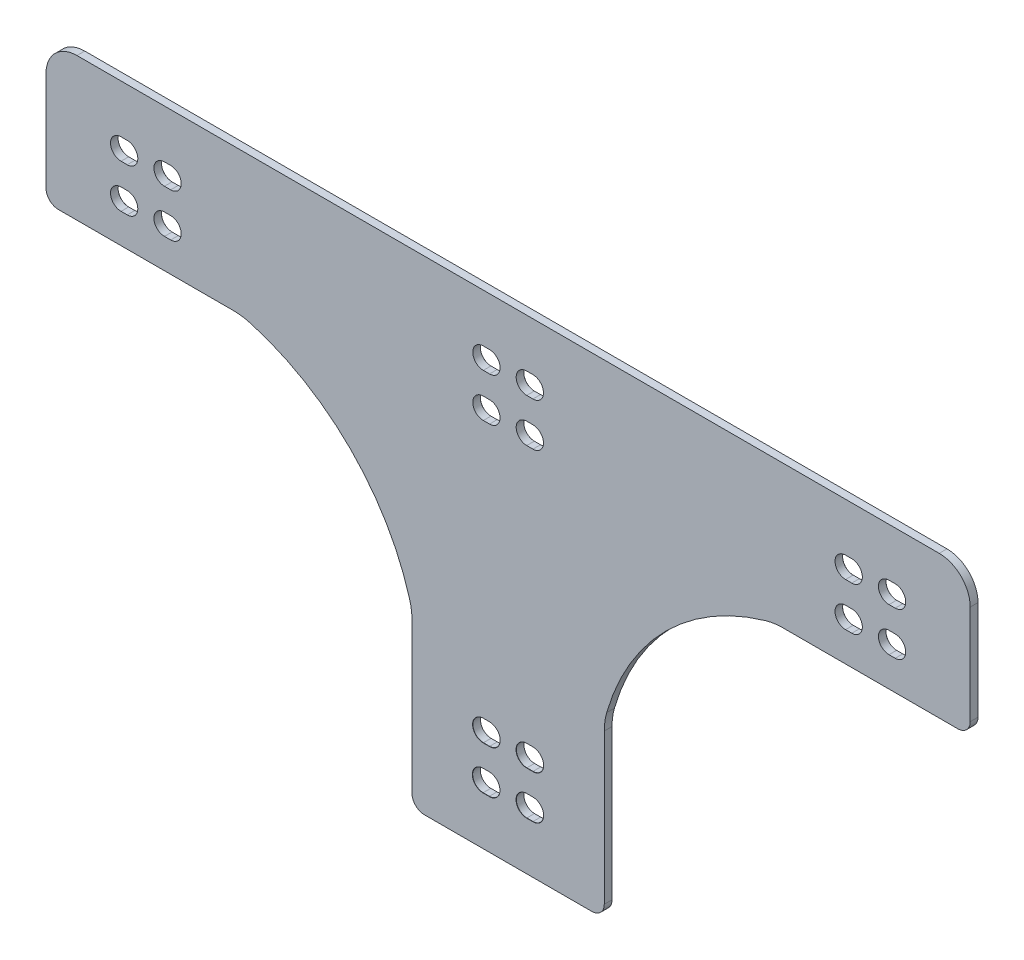
from build123d import *

# Parameters (mm, degrees)
SKETCH2_W                = 1.25
SKETCH2_H                = 78
BASE_FLANGE1_DEPTH       = 149
SKETCH8_W                = 59
SKETCH8_H                = 55
CUT_EXTRUDE1_DEPTH       = 155.024551614
FILLET2_R                = 5
TAB1_DEPTH               = 1.25
FILLET4_R                = 2
FILLET6_R                = 10
M3_START                 = -2
M3_CLEARANCE_SLOT2_DEPTH = 3
M3_START_2               = -1.25
M3_CLEARANCE_SLOT3_DEPTH = 1.25
FILLET7_R                = 2


with BuildPart() as part:
    # Base-Flange1: sheet metal written as solids
    # Sketch2 → Base-Flange1 (new body)
    with BuildSketch(Plane(origin=(0, 0, 0), x_dir=(0, 0, -1), z_dir=(1, 0, 0))):
        with Locations((0.625, 0)):
            Rectangle(SKETCH2_W, SKETCH2_H)
    extrude(amount=BASE_FLANGE1_DEPTH)

    # Sketch8 → Cut-Extrude1 (cut, through all)
    with BuildSketch(Plane.XY):
        with Locations((29.5, -11.5)):
            Rectangle(SKETCH8_W, SKETCH8_H)
        with Locations((119.5, -11.5)):
            Rectangle(SKETCH8_W, SKETCH8_H)
    extrude(amount=-CUT_EXTRUDE1_DEPTH, mode=Mode.SUBTRACT)

    # Fillet2
    fillet2_edges = [part.edges().sort_by_distance(p)[0] for p in [
        (0, 39, -0.625),
        (149, 39, -0.625),
    ]]
    fillet(fillet2_edges, radius=FILLET2_R)

    # Tab1: sheet metal written as solids
    # Sketch9 → Tab1 (add)
    with BuildSketch(Plane.XY):
        with BuildLine():
            Line((117.5, 16), (90, 16))
            Line((90, 16), (90, -11.5))
            ThreePointArc((90, -11.5), (99.90644214, 6.09355786), (117.5, 16))
        make_face()
        with BuildLine():
            Line((59, 16), (59, -11.5))
            ThreePointArc((59, -11.5), (49.09355786, 6.09355786), (31.5, 16))
            Line((31.5, 16), (59, 16))
        make_face()
    extrude(amount=-TAB1_DEPTH)

    # Fillet4
    fillet4_edges = [part.edges().sort_by_distance(p)[0] for p in [
        (0, 16, -0.625),
        (149, 16, -0.625),
    ]]
    fillet(fillet4_edges, radius=FILLET4_R)

    # Fillet6
    fillet6_edges = [part.edges().sort_by_distance(p)[0] for p in [
        (117.5, 16, -0.625),
        (90, -11.5, -0.625),
        (59, -11.5, -0.625),
        (31.5, 16, -0.625),
    ]]
    fillet(fillet6_edges, radius=FILLET6_R)

    # M3 Clearance Slot2: read off the stored shape, not the designer's step
    # M3 Clearance Slot2 outline → M3 Clearance Slot2 (cut)
    with BuildSketch(Plane.XY.offset(M3_START)):
        with BuildLine():
            Line((77.5, -31.2), (78.5, -31.2))
            ThreePointArc((78.5, -31.2), (80.2, -29.5), (78.5, -27.8))
            Line((78.5, -27.8), (77.5, -27.8))
            ThreePointArc((77.5, -27.8), (75.8, -29.5), (77.5, -31.2))
        make_face()
        with BuildLine():
            ThreePointArc((71.461664681, -31.2), (73.161664681, -29.5), (71.461664681, -27.8))
            Line((71.461664681, -27.8), (70.461664681, -27.8))
            ThreePointArc((70.461664681, -27.8), (68.761664681, -29.5), (70.461664681, -31.2))
            Line((70.461664681, -31.2), (71.461664681, -31.2))
        make_face()
        with BuildLine():
            ThreePointArc((71.5, -24.2), (73.2, -22.5), (71.5, -20.8))
            Line((71.5, -20.8), (70.5, -20.8))
            ThreePointArc((70.5, -20.8), (68.8, -22.5), (70.5, -24.2))
            Line((70.5, -24.2), (71.5, -24.2))
        make_face()
        with BuildLine():
            ThreePointArc((78.5, -24.2), (80.2, -22.5), (78.5, -20.8))
            Line((78.5, -20.8), (77.5, -20.8))
            ThreePointArc((77.5, -20.8), (75.8, -22.5), (77.5, -24.2))
            Line((77.5, -24.2), (78.5, -24.2))
        make_face()
    extrude(amount=M3_CLEARANCE_SLOT2_DEPTH, mode=Mode.SUBTRACT)

    # M3 Clearance Slot2 2: loft between two sections, ruled curve by curve
    m3_clearance_slot2_2_from = [
        Edge.make_three_point_arc((78.5, -31.2, -0.025), (79.702081528, -30.702081528, -0.025), (80.2, -29.5, -0.025)),
        Edge.make_three_point_arc((80.2, -29.5, -0.025), (79.702081528, -28.297918472, -0.025), (78.5, -27.8, -0.025)),
        Edge.make_three_point_arc((77.5, -27.8, -0.025), (76.297918472, -28.297918472, -0.025), (75.8, -29.5, -0.025)),
        Edge.make_three_point_arc((75.8, -29.5, -0.025), (76.297918472, -30.702081528, -0.025), (77.5, -31.2, -0.025)),
        Edge.make_line((78.5, -27.8, -0.025), (77.5, -27.8, -0.025)),
        Edge.make_line((78.5, -31.2, -0.025), (77.5, -31.2, -0.025)),
    ]
    m3_clearance_slot2_2_to = [
        Edge.make_three_point_arc((78.5, -31.225, 0), (79.719759198, -30.719759198, 0), (80.225, -29.5, 0)),
        Edge.make_three_point_arc((80.225, -29.5, 0), (79.719759198, -28.280240802, 0), (78.5, -27.775, 0)),
        Edge.make_three_point_arc((77.5, -27.775, 0), (76.280240802, -28.280240802, 0), (75.775, -29.5, 0)),
        Edge.make_three_point_arc((75.775, -29.5, 0), (76.280240802, -30.719759198, 0), (77.5, -31.225, 0)),
        Edge.make_line((78.5, -27.775, 0), (77.5, -27.775, 0)),
        Edge.make_line((78.5, -31.225, 0), (77.5, -31.225, 0)),
    ]
    m3_clearance_slot2_2 = Solid(Shell([*[Face.make_surface_from_curves(m3_clearance_slot2_2_from[k], m3_clearance_slot2_2_to[k]) for k in range(6)], Face(Wire(m3_clearance_slot2_2_from)), Face(Wire(m3_clearance_slot2_2_to))]))
    add(m3_clearance_slot2_2, mode=Mode.SUBTRACT)

    # M3 Clearance Slot2 3: loft between two sections, ruled curve by curve
    m3_clearance_slot2_3_from = [
        Edge.make_three_point_arc((71.461664681, -31.2, -0.025), (72.663746209, -30.702081528, -0.025), (73.161664681, -29.5, -0.025)),
        Edge.make_three_point_arc((73.161664681, -29.5, -0.025), (72.663746209, -28.297918472, -0.025), (71.461664681, -27.8, -0.025)),
        Edge.make_three_point_arc((70.461664681, -27.8, -0.025), (69.259583153, -28.297918472, -0.025), (68.761664681, -29.5, -0.025)),
        Edge.make_three_point_arc((68.761664681, -29.5, -0.025), (69.259583153, -30.702081528, -0.025), (70.461664681, -31.2, -0.025)),
        Edge.make_line((71.461664681, -27.8, -0.025), (70.461664681, -27.8, -0.025)),
        Edge.make_line((71.461664681, -31.2, -0.025), (70.461664681, -31.2, -0.025)),
    ]
    m3_clearance_slot2_3_to = [
        Edge.make_three_point_arc((71.461664681, -31.225, 0), (72.681423878, -30.719759198, 0), (73.186664681, -29.5, 0)),
        Edge.make_three_point_arc((73.186664681, -29.5, 0), (72.681423878, -28.280240802, 0), (71.461664681, -27.775, 0)),
        Edge.make_three_point_arc((70.461664681, -27.775, 0), (69.241905483, -28.280240802, 0), (68.736664681, -29.5, 0)),
        Edge.make_three_point_arc((68.736664681, -29.5, 0), (69.241905483, -30.719759198, 0), (70.461664681, -31.225, 0)),
        Edge.make_line((71.461664681, -27.775, 0), (70.461664681, -27.775, 0)),
        Edge.make_line((71.461664681, -31.225, 0), (70.461664681, -31.225, 0)),
    ]
    m3_clearance_slot2_3 = Solid(Shell([*[Face.make_surface_from_curves(m3_clearance_slot2_3_from[k], m3_clearance_slot2_3_to[k]) for k in range(6)], Face(Wire(m3_clearance_slot2_3_from)), Face(Wire(m3_clearance_slot2_3_to))]))
    add(m3_clearance_slot2_3, mode=Mode.SUBTRACT)

    # M3 Clearance Slot2 4: loft between two sections, ruled curve by curve
    m3_clearance_slot2_4_from = [
        Edge.make_three_point_arc((71.5, -24.2, -0.025), (72.702081528, -23.702081528, -0.025), (73.2, -22.5, -0.025)),
        Edge.make_three_point_arc((73.2, -22.5, -0.025), (72.702081528, -21.297918472, -0.025), (71.5, -20.8, -0.025)),
        Edge.make_three_point_arc((70.5, -20.8, -0.025), (69.297918472, -21.297918472, -0.025), (68.8, -22.5, -0.025)),
        Edge.make_three_point_arc((68.8, -22.5, -0.025), (69.297918472, -23.702081528, -0.025), (70.5, -24.2, -0.025)),
        Edge.make_line((71.5, -20.8, -0.025), (70.5, -20.8, -0.025)),
        Edge.make_line((71.5, -24.2, -0.025), (70.5, -24.2, -0.025)),
    ]
    m3_clearance_slot2_4_to = [
        Edge.make_three_point_arc((71.5, -24.225, 0), (72.719759198, -23.719759198, 0), (73.225, -22.5, 0)),
        Edge.make_three_point_arc((73.225, -22.5, 0), (72.719759198, -21.280240802, 0), (71.5, -20.775, 0)),
        Edge.make_three_point_arc((70.5, -20.775, 0), (69.280240802, -21.280240802, 0), (68.775, -22.5, 0)),
        Edge.make_three_point_arc((68.775, -22.5, 0), (69.280240802, -23.719759198, 0), (70.5, -24.225, 0)),
        Edge.make_line((71.5, -20.775, 0), (70.5, -20.775, 0)),
        Edge.make_line((71.5, -24.225, 0), (70.5, -24.225, 0)),
    ]
    m3_clearance_slot2_4 = Solid(Shell([*[Face.make_surface_from_curves(m3_clearance_slot2_4_from[k], m3_clearance_slot2_4_to[k]) for k in range(6)], Face(Wire(m3_clearance_slot2_4_from)), Face(Wire(m3_clearance_slot2_4_to))]))
    add(m3_clearance_slot2_4, mode=Mode.SUBTRACT)

    # M3 Clearance Slot2 5: loft between two sections, ruled curve by curve
    m3_clearance_slot2_5_from = [
        Edge.make_three_point_arc((78.5, -24.2, -0.025), (79.702081528, -23.702081528, -0.025), (80.2, -22.5, -0.025)),
        Edge.make_three_point_arc((80.2, -22.5, -0.025), (79.702081528, -21.297918472, -0.025), (78.5, -20.8, -0.025)),
        Edge.make_three_point_arc((77.5, -20.8, -0.025), (76.297918472, -21.297918472, -0.025), (75.8, -22.5, -0.025)),
        Edge.make_three_point_arc((75.8, -22.5, -0.025), (76.297918472, -23.702081528, -0.025), (77.5, -24.2, -0.025)),
        Edge.make_line((78.5, -20.8, -0.025), (77.5, -20.8, -0.025)),
        Edge.make_line((78.5, -24.2, -0.025), (77.5, -24.2, -0.025)),
    ]
    m3_clearance_slot2_5_to = [
        Edge.make_three_point_arc((78.5, -24.225, 0), (79.719759198, -23.719759198, 0), (80.225, -22.5, 0)),
        Edge.make_three_point_arc((80.225, -22.5, 0), (79.719759198, -21.280240802, 0), (78.5, -20.775, 0)),
        Edge.make_three_point_arc((77.5, -20.775, 0), (76.280240802, -21.280240802, 0), (75.775, -22.5, 0)),
        Edge.make_three_point_arc((75.775, -22.5, 0), (76.280240802, -23.719759198, 0), (77.5, -24.225, 0)),
        Edge.make_line((78.5, -20.775, 0), (77.5, -20.775, 0)),
        Edge.make_line((78.5, -24.225, 0), (77.5, -24.225, 0)),
    ]
    m3_clearance_slot2_5 = Solid(Shell([*[Face.make_surface_from_curves(m3_clearance_slot2_5_from[k], m3_clearance_slot2_5_to[k]) for k in range(6)], Face(Wire(m3_clearance_slot2_5_from)), Face(Wire(m3_clearance_slot2_5_to))]))
    add(m3_clearance_slot2_5, mode=Mode.SUBTRACT)

    # M3 Clearance Slot3: read off the stored shape, not the designer's step
    # M3 Clearance Slot3 outline → M3 Clearance Slot3 (cut)
    with BuildSketch(Plane.XY.offset(M3_START_2)):
        with BuildLine():
            ThreePointArc((13.098969728, 20.8), (14.798969728, 22.5), (13.098969728, 24.2))
            Line((13.098969728, 24.2), (12.098969728, 24.2))
            ThreePointArc((12.098969728, 24.2), (10.398969728, 22.5), (12.098969728, 20.8))
            Line((12.098969728, 20.8), (13.098969728, 20.8))
        make_face()
        with BuildLine():
            ThreePointArc((19.098969728, 24.2), (17.398969728, 22.5), (19.098969728, 20.8))
            Line((19.098969728, 20.8), (20.098969728, 20.8))
            ThreePointArc((20.098969728, 20.8), (21.798969728, 22.5), (20.098969728, 24.2))
            Line((20.098969728, 24.2), (19.098969728, 24.2))
        make_face()
        with BuildLine():
            ThreePointArc((70.5, 24.2), (68.8, 22.5), (70.5, 20.8))
            Line((70.5, 20.8), (71.5, 20.8))
            ThreePointArc((71.5, 20.8), (73.2, 22.5), (71.5, 24.2))
            Line((71.5, 24.2), (70.5, 24.2))
        make_face()
        with BuildLine():
            ThreePointArc((77.5, 24.2), (75.8, 22.5), (77.5, 20.8))
            Line((77.5, 20.8), (78.5, 20.8))
            ThreePointArc((78.5, 20.8), (80.2, 22.5), (78.5, 24.2))
            Line((78.5, 24.2), (77.5, 24.2))
        make_face()
        with BuildLine():
            ThreePointArc((135.901030272, 24.2), (134.201030272, 22.5), (135.901030272, 20.8))
            Line((135.901030272, 20.8), (136.901030272, 20.8))
            ThreePointArc((136.901030272, 20.8), (138.601030272, 22.5), (136.901030272, 24.2))
            Line((136.901030272, 24.2), (135.901030272, 24.2))
        make_face()
        with BuildLine():
            ThreePointArc((128.901030272, 24.2), (127.201030272, 22.5), (128.901030272, 20.8))
            Line((128.901030272, 20.8), (129.901030272, 20.8))
            ThreePointArc((129.901030272, 20.8), (131.601030272, 22.5), (129.901030272, 24.2))
            Line((129.901030272, 24.2), (128.901030272, 24.2))
        make_face()
        with BuildLine():
            ThreePointArc((20.098969728, 27.8), (21.798969728, 29.5), (20.098969728, 31.2))
            Line((20.098969728, 31.2), (19.098969728, 31.2))
            ThreePointArc((19.098969728, 31.2), (17.398969728, 29.5), (19.098969728, 27.8))
            Line((19.098969728, 27.8), (20.098969728, 27.8))
        make_face()
        with BuildLine():
            ThreePointArc((12.098969728, 31.2), (10.398969728, 29.5), (12.098969728, 27.8))
            Line((12.098969728, 27.8), (13.098969728, 27.8))
            ThreePointArc((13.098969728, 27.8), (14.798969728, 29.5), (13.098969728, 31.2))
            Line((13.098969728, 31.2), (12.098969728, 31.2))
        make_face()
        with BuildLine():
            ThreePointArc((77.5, 31.2), (75.8, 29.5), (77.5, 27.8))
            Line((77.5, 27.8), (78.5, 27.8))
            ThreePointArc((78.5, 27.8), (80.2, 29.5), (78.5, 31.2))
            Line((78.5, 31.2), (77.5, 31.2))
        make_face()
        with BuildLine():
            ThreePointArc((70.5, 31.2), (68.8, 29.5), (70.5, 27.8))
            Line((70.5, 27.8), (71.5, 27.8))
            ThreePointArc((71.5, 27.8), (73.2, 29.5), (71.5, 31.2))
            Line((71.5, 31.2), (70.5, 31.2))
        make_face()
        with BuildLine():
            ThreePointArc((128.901030272, 31.2), (127.201030272, 29.5), (128.901030272, 27.8))
            Line((128.901030272, 27.8), (129.901030272, 27.8))
            ThreePointArc((129.901030272, 27.8), (131.601030272, 29.5), (129.901030272, 31.2))
            Line((129.901030272, 31.2), (128.901030272, 31.2))
        make_face()
        with BuildLine():
            ThreePointArc((135.901030272, 31.2), (134.201030272, 29.5), (135.901030272, 27.8))
            Line((135.901030272, 27.8), (136.901030272, 27.8))
            ThreePointArc((136.901030272, 27.8), (138.601030272, 29.5), (136.901030272, 31.2))
            Line((136.901030272, 31.2), (135.901030272, 31.2))
        make_face()
    extrude(amount=M3_CLEARANCE_SLOT3_DEPTH, mode=Mode.SUBTRACT)

    # M3 Clearance Slot3 2: loft between two sections, ruled curve by curve
    m3_clearance_slot3_2_from = [
        Edge.make_three_point_arc((13.098969728, 24.2, -1.225), (14.301051256, 23.702081528, -1.225), (14.798969728, 22.5, -1.225)),
        Edge.make_three_point_arc((14.798969728, 22.5, -1.225), (14.301051256, 21.297918472, -1.225), (13.098969728, 20.8, -1.225)),
        Edge.make_three_point_arc((12.098969728, 20.8, -1.225), (10.8968882, 21.297918472, -1.225), (10.398969728, 22.5, -1.225)),
        Edge.make_three_point_arc((10.398969728, 22.5, -1.225), (10.8968882, 23.702081528, -1.225), (12.098969728, 24.2, -1.225)),
        Edge.make_line((13.098969728, 20.8, -1.225), (12.098969728, 20.8, -1.225)),
        Edge.make_line((13.098969728, 24.2, -1.225), (12.098969728, 24.2, -1.225)),
    ]
    m3_clearance_slot3_2_to = [
        Edge.make_three_point_arc((13.098969728, 24.225, -1.25), (14.318728925, 23.719759198, -1.25), (14.823969728, 22.5, -1.25)),
        Edge.make_three_point_arc((14.823969728, 22.5, -1.25), (14.318728925, 21.280240802, -1.25), (13.098969728, 20.775, -1.25)),
        Edge.make_three_point_arc((12.098969728, 20.775, -1.25), (10.87921053, 21.280240802, -1.25), (10.373969728, 22.5, -1.25)),
        Edge.make_three_point_arc((10.373969728, 22.5, -1.25), (10.87921053, 23.719759198, -1.25), (12.098969728, 24.225, -1.25)),
        Edge.make_line((13.098969728, 20.775, -1.25), (12.098969728, 20.775, -1.25)),
        Edge.make_line((13.098969728, 24.225, -1.25), (12.098969728, 24.225, -1.25)),
    ]
    m3_clearance_slot3_2 = Solid(Shell([*[Face.make_surface_from_curves(m3_clearance_slot3_2_from[k], m3_clearance_slot3_2_to[k]) for k in range(6)], Face(Wire(m3_clearance_slot3_2_from)), Face(Wire(m3_clearance_slot3_2_to))]))
    add(m3_clearance_slot3_2, mode=Mode.SUBTRACT)

    # M3 Clearance Slot3 3: loft between two sections, ruled curve by curve
    m3_clearance_slot3_3_from = [
        Edge.make_three_point_arc((20.098969728, 24.2, -1.225), (21.301051256, 23.702081528, -1.225), (21.798969728, 22.5, -1.225)),
        Edge.make_three_point_arc((21.798969728, 22.5, -1.225), (21.301051256, 21.297918472, -1.225), (20.098969728, 20.8, -1.225)),
        Edge.make_three_point_arc((19.098969728, 20.8, -1.225), (17.8968882, 21.297918472, -1.225), (17.398969728, 22.5, -1.225)),
        Edge.make_three_point_arc((17.398969728, 22.5, -1.225), (17.8968882, 23.702081528, -1.225), (19.098969728, 24.2, -1.225)),
        Edge.make_line((20.098969728, 20.8, -1.225), (19.098969728, 20.8, -1.225)),
        Edge.make_line((20.098969728, 24.2, -1.225), (19.098969728, 24.2, -1.225)),
    ]
    m3_clearance_slot3_3_to = [
        Edge.make_three_point_arc((20.098969728, 24.225, -1.25), (21.318728925, 23.719759198, -1.25), (21.823969728, 22.5, -1.25)),
        Edge.make_three_point_arc((21.823969728, 22.5, -1.25), (21.318728925, 21.280240802, -1.25), (20.098969728, 20.775, -1.25)),
        Edge.make_three_point_arc((19.098969728, 20.775, -1.25), (17.87921053, 21.280240802, -1.25), (17.373969728, 22.5, -1.25)),
        Edge.make_three_point_arc((17.373969728, 22.5, -1.25), (17.87921053, 23.719759198, -1.25), (19.098969728, 24.225, -1.25)),
        Edge.make_line((20.098969728, 20.775, -1.25), (19.098969728, 20.775, -1.25)),
        Edge.make_line((20.098969728, 24.225, -1.25), (19.098969728, 24.225, -1.25)),
    ]
    m3_clearance_slot3_3 = Solid(Shell([*[Face.make_surface_from_curves(m3_clearance_slot3_3_from[k], m3_clearance_slot3_3_to[k]) for k in range(6)], Face(Wire(m3_clearance_slot3_3_from)), Face(Wire(m3_clearance_slot3_3_to))]))
    add(m3_clearance_slot3_3, mode=Mode.SUBTRACT)

    # M3 Clearance Slot3 4: loft between two sections, ruled curve by curve
    m3_clearance_slot3_4_from = [
        Edge.make_three_point_arc((71.5, 24.2, -1.225), (72.702081528, 23.702081528, -1.225), (73.2, 22.5, -1.225)),
        Edge.make_three_point_arc((73.2, 22.5, -1.225), (72.702081528, 21.297918472, -1.225), (71.5, 20.8, -1.225)),
        Edge.make_three_point_arc((70.5, 20.8, -1.225), (69.297918472, 21.297918472, -1.225), (68.8, 22.5, -1.225)),
        Edge.make_three_point_arc((68.8, 22.5, -1.225), (69.297918472, 23.702081528, -1.225), (70.5, 24.2, -1.225)),
        Edge.make_line((71.5, 20.8, -1.225), (70.5, 20.8, -1.225)),
        Edge.make_line((71.5, 24.2, -1.225), (70.5, 24.2, -1.225)),
    ]
    m3_clearance_slot3_4_to = [
        Edge.make_three_point_arc((71.5, 24.225, -1.25), (72.719759198, 23.719759198, -1.25), (73.225, 22.5, -1.25)),
        Edge.make_three_point_arc((73.225, 22.5, -1.25), (72.719759198, 21.280240802, -1.25), (71.5, 20.775, -1.25)),
        Edge.make_three_point_arc((70.5, 20.775, -1.25), (69.280240802, 21.280240802, -1.25), (68.775, 22.5, -1.25)),
        Edge.make_three_point_arc((68.775, 22.5, -1.25), (69.280240802, 23.719759198, -1.25), (70.5, 24.225, -1.25)),
        Edge.make_line((71.5, 20.775, -1.25), (70.5, 20.775, -1.25)),
        Edge.make_line((71.5, 24.225, -1.25), (70.5, 24.225, -1.25)),
    ]
    m3_clearance_slot3_4 = Solid(Shell([*[Face.make_surface_from_curves(m3_clearance_slot3_4_from[k], m3_clearance_slot3_4_to[k]) for k in range(6)], Face(Wire(m3_clearance_slot3_4_from)), Face(Wire(m3_clearance_slot3_4_to))]))
    add(m3_clearance_slot3_4, mode=Mode.SUBTRACT)

    # M3 Clearance Slot3 5: loft between two sections, ruled curve by curve
    m3_clearance_slot3_5_from = [
        Edge.make_three_point_arc((78.5, 24.2, -1.225), (79.702081528, 23.702081528, -1.225), (80.2, 22.5, -1.225)),
        Edge.make_three_point_arc((80.2, 22.5, -1.225), (79.702081528, 21.297918472, -1.225), (78.5, 20.8, -1.225)),
        Edge.make_three_point_arc((77.5, 20.8, -1.225), (76.297918472, 21.297918472, -1.225), (75.8, 22.5, -1.225)),
        Edge.make_three_point_arc((75.8, 22.5, -1.225), (76.297918472, 23.702081528, -1.225), (77.5, 24.2, -1.225)),
        Edge.make_line((78.5, 20.8, -1.225), (77.5, 20.8, -1.225)),
        Edge.make_line((78.5, 24.2, -1.225), (77.5, 24.2, -1.225)),
    ]
    m3_clearance_slot3_5_to = [
        Edge.make_three_point_arc((78.5, 24.225, -1.25), (79.719759198, 23.719759198, -1.25), (80.225, 22.5, -1.25)),
        Edge.make_three_point_arc((80.225, 22.5, -1.25), (79.719759198, 21.280240802, -1.25), (78.5, 20.775, -1.25)),
        Edge.make_three_point_arc((77.5, 20.775, -1.25), (76.280240802, 21.280240802, -1.25), (75.775, 22.5, -1.25)),
        Edge.make_three_point_arc((75.775, 22.5, -1.25), (76.280240802, 23.719759198, -1.25), (77.5, 24.225, -1.25)),
        Edge.make_line((78.5, 20.775, -1.25), (77.5, 20.775, -1.25)),
        Edge.make_line((78.5, 24.225, -1.25), (77.5, 24.225, -1.25)),
    ]
    m3_clearance_slot3_5 = Solid(Shell([*[Face.make_surface_from_curves(m3_clearance_slot3_5_from[k], m3_clearance_slot3_5_to[k]) for k in range(6)], Face(Wire(m3_clearance_slot3_5_from)), Face(Wire(m3_clearance_slot3_5_to))]))
    add(m3_clearance_slot3_5, mode=Mode.SUBTRACT)

    # M3 Clearance Slot3 6: loft between two sections, ruled curve by curve
    m3_clearance_slot3_6_from = [
        Edge.make_three_point_arc((136.901030272, 24.2, -1.225), (138.1031118, 23.702081528, -1.225), (138.601030272, 22.5, -1.225)),
        Edge.make_three_point_arc((138.601030272, 22.5, -1.225), (138.1031118, 21.297918472, -1.225), (136.901030272, 20.8, -1.225)),
        Edge.make_three_point_arc((135.901030272, 20.8, -1.225), (134.698948744, 21.297918472, -1.225), (134.201030272, 22.5, -1.225)),
        Edge.make_three_point_arc((134.201030272, 22.5, -1.225), (134.698948744, 23.702081528, -1.225), (135.901030272, 24.2, -1.225)),
        Edge.make_line((136.901030272, 20.8, -1.225), (135.901030272, 20.8, -1.225)),
        Edge.make_line((136.901030272, 24.2, -1.225), (135.901030272, 24.2, -1.225)),
    ]
    m3_clearance_slot3_6_to = [
        Edge.make_three_point_arc((136.901030272, 24.225, -1.25), (138.12078947, 23.719759198, -1.25), (138.626030272, 22.5, -1.25)),
        Edge.make_three_point_arc((138.626030272, 22.5, -1.25), (138.12078947, 21.280240802, -1.25), (136.901030272, 20.775, -1.25)),
        Edge.make_three_point_arc((135.901030272, 20.775, -1.25), (134.681271075, 21.280240802, -1.25), (134.176030272, 22.5, -1.25)),
        Edge.make_three_point_arc((134.176030272, 22.5, -1.25), (134.681271075, 23.719759198, -1.25), (135.901030272, 24.225, -1.25)),
        Edge.make_line((136.901030272, 20.775, -1.25), (135.901030272, 20.775, -1.25)),
        Edge.make_line((136.901030272, 24.225, -1.25), (135.901030272, 24.225, -1.25)),
    ]
    m3_clearance_slot3_6 = Solid(Shell([*[Face.make_surface_from_curves(m3_clearance_slot3_6_from[k], m3_clearance_slot3_6_to[k]) for k in range(6)], Face(Wire(m3_clearance_slot3_6_from)), Face(Wire(m3_clearance_slot3_6_to))]))
    add(m3_clearance_slot3_6, mode=Mode.SUBTRACT)

    # M3 Clearance Slot3 7: loft between two sections, ruled curve by curve
    m3_clearance_slot3_7_from = [
        Edge.make_three_point_arc((129.901030272, 24.2, -1.225), (131.1031118, 23.702081528, -1.225), (131.601030272, 22.5, -1.225)),
        Edge.make_three_point_arc((131.601030272, 22.5, -1.225), (131.1031118, 21.297918472, -1.225), (129.901030272, 20.8, -1.225)),
        Edge.make_three_point_arc((128.901030272, 20.8, -1.225), (127.698948744, 21.297918472, -1.225), (127.201030272, 22.5, -1.225)),
        Edge.make_three_point_arc((127.201030272, 22.5, -1.225), (127.698948744, 23.702081528, -1.225), (128.901030272, 24.2, -1.225)),
        Edge.make_line((129.901030272, 20.8, -1.225), (128.901030272, 20.8, -1.225)),
        Edge.make_line((129.901030272, 24.2, -1.225), (128.901030272, 24.2, -1.225)),
    ]
    m3_clearance_slot3_7_to = [
        Edge.make_three_point_arc((129.901030272, 24.225, -1.25), (131.12078947, 23.719759198, -1.25), (131.626030272, 22.5, -1.25)),
        Edge.make_three_point_arc((131.626030272, 22.5, -1.25), (131.12078947, 21.280240802, -1.25), (129.901030272, 20.775, -1.25)),
        Edge.make_three_point_arc((128.901030272, 20.775, -1.25), (127.681271075, 21.280240802, -1.25), (127.176030272, 22.5, -1.25)),
        Edge.make_three_point_arc((127.176030272, 22.5, -1.25), (127.681271075, 23.719759198, -1.25), (128.901030272, 24.225, -1.25)),
        Edge.make_line((129.901030272, 20.775, -1.25), (128.901030272, 20.775, -1.25)),
        Edge.make_line((129.901030272, 24.225, -1.25), (128.901030272, 24.225, -1.25)),
    ]
    m3_clearance_slot3_7 = Solid(Shell([*[Face.make_surface_from_curves(m3_clearance_slot3_7_from[k], m3_clearance_slot3_7_to[k]) for k in range(6)], Face(Wire(m3_clearance_slot3_7_from)), Face(Wire(m3_clearance_slot3_7_to))]))
    add(m3_clearance_slot3_7, mode=Mode.SUBTRACT)

    # M3 Clearance Slot3 8: loft between two sections, ruled curve by curve
    m3_clearance_slot3_8_from = [
        Edge.make_three_point_arc((20.098969728, 31.2, -1.225), (21.301051256, 30.702081528, -1.225), (21.798969728, 29.5, -1.225)),
        Edge.make_three_point_arc((21.798969728, 29.5, -1.225), (21.301051256, 28.297918472, -1.225), (20.098969728, 27.8, -1.225)),
        Edge.make_three_point_arc((19.098969728, 27.8, -1.225), (17.8968882, 28.297918472, -1.225), (17.398969728, 29.5, -1.225)),
        Edge.make_three_point_arc((17.398969728, 29.5, -1.225), (17.8968882, 30.702081528, -1.225), (19.098969728, 31.2, -1.225)),
        Edge.make_line((20.098969728, 27.8, -1.225), (19.098969728, 27.8, -1.225)),
        Edge.make_line((20.098969728, 31.2, -1.225), (19.098969728, 31.2, -1.225)),
    ]
    m3_clearance_slot3_8_to = [
        Edge.make_three_point_arc((20.098969728, 31.225, -1.25), (21.318728925, 30.719759198, -1.25), (21.823969728, 29.5, -1.25)),
        Edge.make_three_point_arc((21.823969728, 29.5, -1.25), (21.318728925, 28.280240802, -1.25), (20.098969728, 27.775, -1.25)),
        Edge.make_three_point_arc((19.098969728, 27.775, -1.25), (17.87921053, 28.280240802, -1.25), (17.373969728, 29.5, -1.25)),
        Edge.make_three_point_arc((17.373969728, 29.5, -1.25), (17.87921053, 30.719759198, -1.25), (19.098969728, 31.225, -1.25)),
        Edge.make_line((20.098969728, 27.775, -1.25), (19.098969728, 27.775, -1.25)),
        Edge.make_line((20.098969728, 31.225, -1.25), (19.098969728, 31.225, -1.25)),
    ]
    m3_clearance_slot3_8 = Solid(Shell([*[Face.make_surface_from_curves(m3_clearance_slot3_8_from[k], m3_clearance_slot3_8_to[k]) for k in range(6)], Face(Wire(m3_clearance_slot3_8_from)), Face(Wire(m3_clearance_slot3_8_to))]))
    add(m3_clearance_slot3_8, mode=Mode.SUBTRACT)

    # M3 Clearance Slot3 9: loft between two sections, ruled curve by curve
    m3_clearance_slot3_9_from = [
        Edge.make_three_point_arc((13.098969728, 31.2, -1.225), (14.301051256, 30.702081528, -1.225), (14.798969728, 29.5, -1.225)),
        Edge.make_three_point_arc((14.798969728, 29.5, -1.225), (14.301051256, 28.297918472, -1.225), (13.098969728, 27.8, -1.225)),
        Edge.make_three_point_arc((12.098969728, 27.8, -1.225), (10.8968882, 28.297918472, -1.225), (10.398969728, 29.5, -1.225)),
        Edge.make_three_point_arc((10.398969728, 29.5, -1.225), (10.8968882, 30.702081528, -1.225), (12.098969728, 31.2, -1.225)),
        Edge.make_line((13.098969728, 27.8, -1.225), (12.098969728, 27.8, -1.225)),
        Edge.make_line((13.098969728, 31.2, -1.225), (12.098969728, 31.2, -1.225)),
    ]
    m3_clearance_slot3_9_to = [
        Edge.make_three_point_arc((13.098969728, 31.225, -1.25), (14.318728925, 30.719759198, -1.25), (14.823969728, 29.5, -1.25)),
        Edge.make_three_point_arc((14.823969728, 29.5, -1.25), (14.318728925, 28.280240802, -1.25), (13.098969728, 27.775, -1.25)),
        Edge.make_three_point_arc((12.098969728, 27.775, -1.25), (10.87921053, 28.280240802, -1.25), (10.373969728, 29.5, -1.25)),
        Edge.make_three_point_arc((10.373969728, 29.5, -1.25), (10.87921053, 30.719759198, -1.25), (12.098969728, 31.225, -1.25)),
        Edge.make_line((13.098969728, 27.775, -1.25), (12.098969728, 27.775, -1.25)),
        Edge.make_line((13.098969728, 31.225, -1.25), (12.098969728, 31.225, -1.25)),
    ]
    m3_clearance_slot3_9 = Solid(Shell([*[Face.make_surface_from_curves(m3_clearance_slot3_9_from[k], m3_clearance_slot3_9_to[k]) for k in range(6)], Face(Wire(m3_clearance_slot3_9_from)), Face(Wire(m3_clearance_slot3_9_to))]))
    add(m3_clearance_slot3_9, mode=Mode.SUBTRACT)

    # M3 Clearance Slot3 10: loft between two sections, ruled curve by curve
    m3_clearance_slot3_10_from = [
        Edge.make_three_point_arc((78.5, 31.2, -1.225), (79.702081528, 30.702081528, -1.225), (80.2, 29.5, -1.225)),
        Edge.make_three_point_arc((80.2, 29.5, -1.225), (79.702081528, 28.297918472, -1.225), (78.5, 27.8, -1.225)),
        Edge.make_three_point_arc((77.5, 27.8, -1.225), (76.297918472, 28.297918472, -1.225), (75.8, 29.5, -1.225)),
        Edge.make_three_point_arc((75.8, 29.5, -1.225), (76.297918472, 30.702081528, -1.225), (77.5, 31.2, -1.225)),
        Edge.make_line((78.5, 27.8, -1.225), (77.5, 27.8, -1.225)),
        Edge.make_line((78.5, 31.2, -1.225), (77.5, 31.2, -1.225)),
    ]
    m3_clearance_slot3_10_to = [
        Edge.make_three_point_arc((78.5, 31.225, -1.25), (79.719759198, 30.719759198, -1.25), (80.225, 29.5, -1.25)),
        Edge.make_three_point_arc((80.225, 29.5, -1.25), (79.719759198, 28.280240802, -1.25), (78.5, 27.775, -1.25)),
        Edge.make_three_point_arc((77.5, 27.775, -1.25), (76.280240802, 28.280240802, -1.25), (75.775, 29.5, -1.25)),
        Edge.make_three_point_arc((75.775, 29.5, -1.25), (76.280240802, 30.719759198, -1.25), (77.5, 31.225, -1.25)),
        Edge.make_line((78.5, 27.775, -1.25), (77.5, 27.775, -1.25)),
        Edge.make_line((78.5, 31.225, -1.25), (77.5, 31.225, -1.25)),
    ]
    m3_clearance_slot3_10 = Solid(Shell([*[Face.make_surface_from_curves(m3_clearance_slot3_10_from[k], m3_clearance_slot3_10_to[k]) for k in range(6)], Face(Wire(m3_clearance_slot3_10_from)), Face(Wire(m3_clearance_slot3_10_to))]))
    add(m3_clearance_slot3_10, mode=Mode.SUBTRACT)

    # M3 Clearance Slot3 11: loft between two sections, ruled curve by curve
    m3_clearance_slot3_11_from = [
        Edge.make_three_point_arc((71.5, 31.2, -1.225), (72.702081528, 30.702081528, -1.225), (73.2, 29.5, -1.225)),
        Edge.make_three_point_arc((73.2, 29.5, -1.225), (72.702081528, 28.297918472, -1.225), (71.5, 27.8, -1.225)),
        Edge.make_three_point_arc((70.5, 27.8, -1.225), (69.297918472, 28.297918472, -1.225), (68.8, 29.5, -1.225)),
        Edge.make_three_point_arc((68.8, 29.5, -1.225), (69.297918472, 30.702081528, -1.225), (70.5, 31.2, -1.225)),
        Edge.make_line((71.5, 27.8, -1.225), (70.5, 27.8, -1.225)),
        Edge.make_line((71.5, 31.2, -1.225), (70.5, 31.2, -1.225)),
    ]
    m3_clearance_slot3_11_to = [
        Edge.make_three_point_arc((71.5, 31.225, -1.25), (72.719759198, 30.719759198, -1.25), (73.225, 29.5, -1.25)),
        Edge.make_three_point_arc((73.225, 29.5, -1.25), (72.719759198, 28.280240802, -1.25), (71.5, 27.775, -1.25)),
        Edge.make_three_point_arc((70.5, 27.775, -1.25), (69.280240802, 28.280240802, -1.25), (68.775, 29.5, -1.25)),
        Edge.make_three_point_arc((68.775, 29.5, -1.25), (69.280240802, 30.719759198, -1.25), (70.5, 31.225, -1.25)),
        Edge.make_line((71.5, 27.775, -1.25), (70.5, 27.775, -1.25)),
        Edge.make_line((71.5, 31.225, -1.25), (70.5, 31.225, -1.25)),
    ]
    m3_clearance_slot3_11 = Solid(Shell([*[Face.make_surface_from_curves(m3_clearance_slot3_11_from[k], m3_clearance_slot3_11_to[k]) for k in range(6)], Face(Wire(m3_clearance_slot3_11_from)), Face(Wire(m3_clearance_slot3_11_to))]))
    add(m3_clearance_slot3_11, mode=Mode.SUBTRACT)

    # M3 Clearance Slot3 12: loft between two sections, ruled curve by curve
    m3_clearance_slot3_12_from = [
        Edge.make_three_point_arc((129.901030272, 31.2, -1.225), (131.1031118, 30.702081528, -1.225), (131.601030272, 29.5, -1.225)),
        Edge.make_three_point_arc((131.601030272, 29.5, -1.225), (131.1031118, 28.297918472, -1.225), (129.901030272, 27.8, -1.225)),
        Edge.make_three_point_arc((128.901030272, 27.8, -1.225), (127.698948744, 28.297918472, -1.225), (127.201030272, 29.5, -1.225)),
        Edge.make_three_point_arc((127.201030272, 29.5, -1.225), (127.698948744, 30.702081528, -1.225), (128.901030272, 31.2, -1.225)),
        Edge.make_line((129.901030272, 27.8, -1.225), (128.901030272, 27.8, -1.225)),
        Edge.make_line((129.901030272, 31.2, -1.225), (128.901030272, 31.2, -1.225)),
    ]
    m3_clearance_slot3_12_to = [
        Edge.make_three_point_arc((129.901030272, 31.225, -1.25), (131.12078947, 30.719759198, -1.25), (131.626030272, 29.5, -1.25)),
        Edge.make_three_point_arc((131.626030272, 29.5, -1.25), (131.12078947, 28.280240802, -1.25), (129.901030272, 27.775, -1.25)),
        Edge.make_three_point_arc((128.901030272, 27.775, -1.25), (127.681271075, 28.280240802, -1.25), (127.176030272, 29.5, -1.25)),
        Edge.make_three_point_arc((127.176030272, 29.5, -1.25), (127.681271075, 30.719759198, -1.25), (128.901030272, 31.225, -1.25)),
        Edge.make_line((129.901030272, 27.775, -1.25), (128.901030272, 27.775, -1.25)),
        Edge.make_line((129.901030272, 31.225, -1.25), (128.901030272, 31.225, -1.25)),
    ]
    m3_clearance_slot3_12 = Solid(Shell([*[Face.make_surface_from_curves(m3_clearance_slot3_12_from[k], m3_clearance_slot3_12_to[k]) for k in range(6)], Face(Wire(m3_clearance_slot3_12_from)), Face(Wire(m3_clearance_slot3_12_to))]))
    add(m3_clearance_slot3_12, mode=Mode.SUBTRACT)

    # M3 Clearance Slot3 13: loft between two sections, ruled curve by curve
    m3_clearance_slot3_13_from = [
        Edge.make_three_point_arc((136.901030272, 31.2, -1.225), (138.1031118, 30.702081528, -1.225), (138.601030272, 29.5, -1.225)),
        Edge.make_three_point_arc((138.601030272, 29.5, -1.225), (138.1031118, 28.297918472, -1.225), (136.901030272, 27.8, -1.225)),
        Edge.make_three_point_arc((135.901030272, 27.8, -1.225), (134.698948744, 28.297918472, -1.225), (134.201030272, 29.5, -1.225)),
        Edge.make_three_point_arc((134.201030272, 29.5, -1.225), (134.698948744, 30.702081528, -1.225), (135.901030272, 31.2, -1.225)),
        Edge.make_line((136.901030272, 27.8, -1.225), (135.901030272, 27.8, -1.225)),
        Edge.make_line((136.901030272, 31.2, -1.225), (135.901030272, 31.2, -1.225)),
    ]
    m3_clearance_slot3_13_to = [
        Edge.make_three_point_arc((136.901030272, 31.225, -1.25), (138.12078947, 30.719759198, -1.25), (138.626030272, 29.5, -1.25)),
        Edge.make_three_point_arc((138.626030272, 29.5, -1.25), (138.12078947, 28.280240802, -1.25), (136.901030272, 27.775, -1.25)),
        Edge.make_three_point_arc((135.901030272, 27.775, -1.25), (134.681271075, 28.280240802, -1.25), (134.176030272, 29.5, -1.25)),
        Edge.make_three_point_arc((134.176030272, 29.5, -1.25), (134.681271075, 30.719759198, -1.25), (135.901030272, 31.225, -1.25)),
        Edge.make_line((136.901030272, 27.775, -1.25), (135.901030272, 27.775, -1.25)),
        Edge.make_line((136.901030272, 31.225, -1.25), (135.901030272, 31.225, -1.25)),
    ]
    m3_clearance_slot3_13 = Solid(Shell([*[Face.make_surface_from_curves(m3_clearance_slot3_13_from[k], m3_clearance_slot3_13_to[k]) for k in range(6)], Face(Wire(m3_clearance_slot3_13_from)), Face(Wire(m3_clearance_slot3_13_to))]))
    add(m3_clearance_slot3_13, mode=Mode.SUBTRACT)

    # Fillet7
    fillet7_edges = [part.edges().sort_by_distance(p)[0] for p in [
        (59, -39, -0.625),
        (90, -39, -0.625),
    ]]
    fillet(fillet7_edges, radius=FILLET7_R)


solid = part.part
